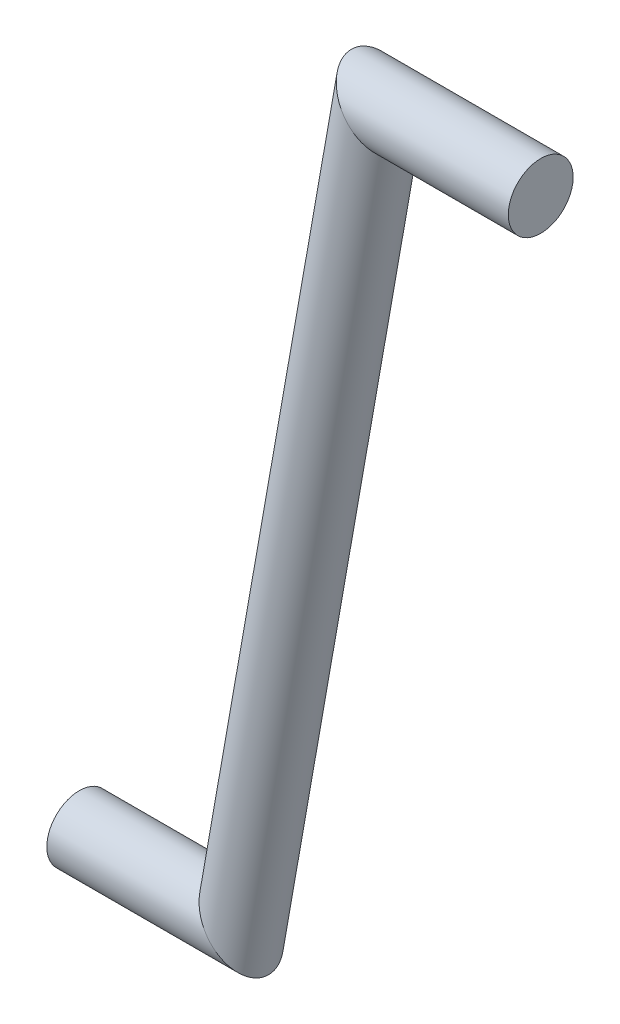
from build123d import *

# Parameters (mm, degrees)
SKETCH4_R = 6.35


with BuildPart() as part:
    # Sweep3: sweep along a path in Sketch5
    with BuildLine(Plane.XY) as sweep3_path:
        Line((0, 0), (31.75, 0))
        Line((31.75, 0), (58.62223186, 152.4))
        Line((58.62223186, 152.4), (90.37223186, 152.4))
    # Sketch4 → Sweep3 (sweep)
    with BuildSketch(Plane(origin=(0, 0, 0), x_dir=(0, 0, -1), z_dir=(1, 0, 0))):
        Circle(SKETCH4_R)
    sweep(path=sweep3_path.line, transition=Transition.RIGHT)


solid = part.part
